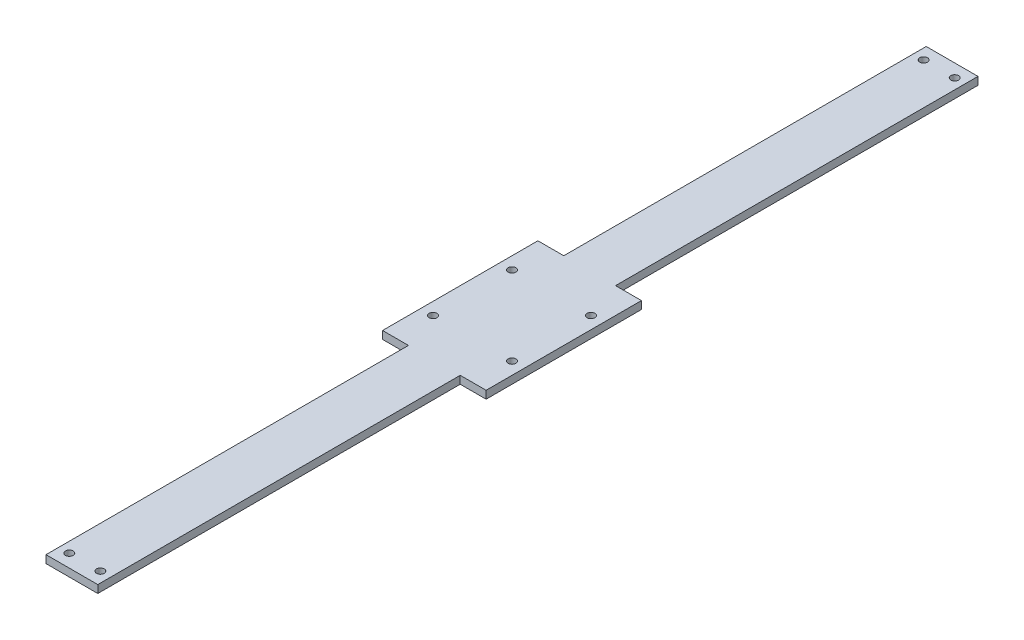
from build123d import *

# Parameters (mm, degrees)
BOSS_EXTRUDE1_DEPTH      = 1.5
FC_MOUNT_HOLE_D          = 3
F_3_0_3_DIAMETER_HOLE1_D = 3


with BuildPart() as part:
    # Sketch1 → Boss-Extrude1 (new, symmetric)
    with BuildSketch(Plane(origin=(0, 0, 0), x_dir=(1, 0, 0), z_dir=(0, 1, 0))):
        Polygon((-10, 170), (-10, 30), (-20, 30), (-20, -30), (-10, -30), (-10, -170), (10, -170), (10, -30), (20, -30), (20, 30), (10, 30), (10, 170), align=None)
    extrude(amount=BOSS_EXTRUDE1_DEPTH, both=True)

    # fc mount hole (through all)
    with Locations(Plane(origin=(0, 1.5, 0), x_dir=(1, 0, 0), z_dir=(0, 1, 0))):
        with Locations((-15.25, 15.25), (15.25, 15.25), (15.25, -15.25), (-15.25, -15.25)):
            Hole(FC_MOUNT_HOLE_D / 2)

    # Ø3.0 (3) Diameter Hole1 (through all)
    with Locations(Plane(origin=(0, 1.5, 0), x_dir=(1, 0, 0), z_dir=(0, 1, 0))):
        with Locations((6, -165), (-6, -165)):
            f_3_0_3_diameter_hole1 = Hole(F_3_0_3_DIAMETER_HOLE1_D / 2)

    # Mirror1: Ø3.0 (3) Diameter Hole1 across plane
    add(f_3_0_3_diameter_hole1.mirror(Plane.XY), mode=Mode.SUBTRACT)


solid = part.part
